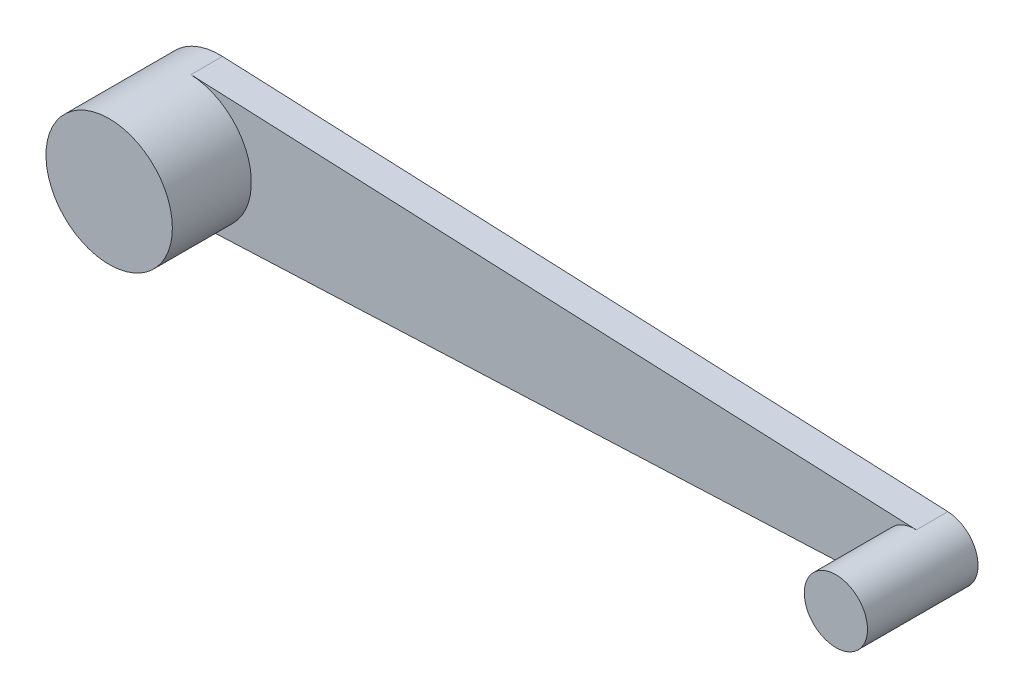
from build123d import *

# Parameters (mm, degrees)
BOSS_EXTRUDE1_DEPTH = 2
SKETCH3_R           = 4
SKETCH3_R_2         = 2.000000000000003
BOSS_EXTRUDE2_DEPTH = 5


with BuildPart() as part:
    # Sketch2 → Boss-Extrude1 (new body)
    with BuildSketch(Plane.XY):
        with BuildLine():
            Line((0.1739130434782606, 3.996217493243845), (46.08695652173913, 1.9981087466219258))
            ThreePointArc((46.08695652173913, 1.9981087466219258), (48, 0), (46.08695652173913, -1.9981087466219258))
            Line((46.08695652173913, -1.9981087466219258), (0.17391304347826061, -3.996217493243846))
            ThreePointArc((0.17391304347826061, -3.996217493243846), (-3.999999999999999, 4.9e-16), (0.1739130434782606, 3.996217493243845))
        make_face()
    extrude(amount=BOSS_EXTRUDE1_DEPTH)

    # Sketch3 → Boss-Extrude2 (add)
    with BuildSketch(Plane.XY.offset(2)):
        Circle(SKETCH3_R)
        with Locations((46, 0)):
            Circle(SKETCH3_R_2)
    extrude(amount=BOSS_EXTRUDE2_DEPTH)


solid = part.part
